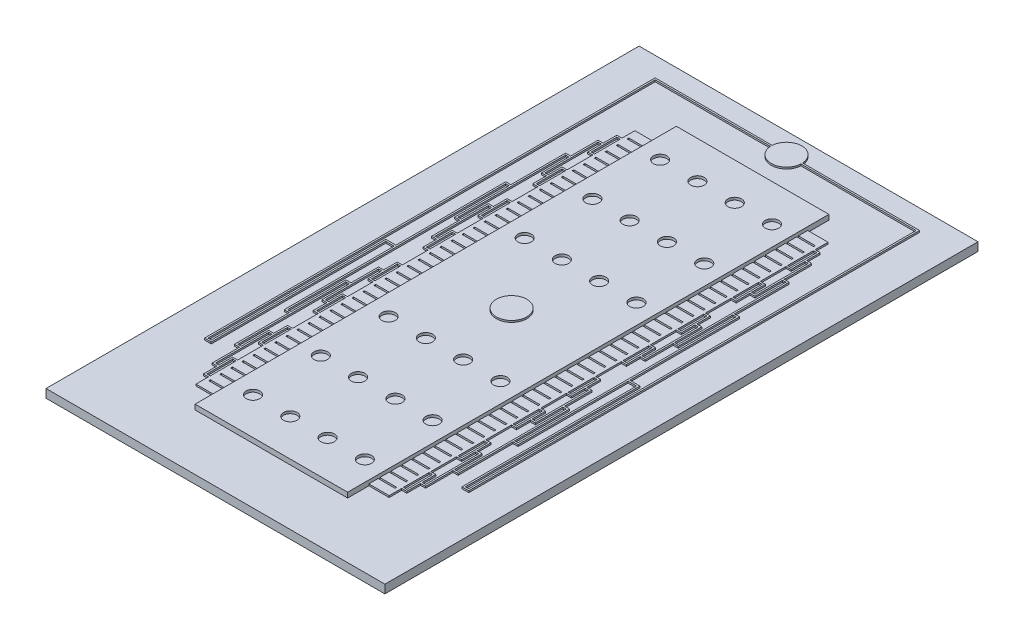
from build123d import *

# Parameters (mm, degrees)
SKETCH2_W           = 20
SKETCH2_H           = 35
BOSS_EXTRUDE1_DEPTH = 0.5
SKETCH3_W           = 9
SKETCH3_H           = 28.4
BOSS_EXTRUDE2_DEPTH = 0.3
SKETCH6_W           = 1.2
SKETCH6_H           = 25.9
BOSS_EXTRUDE3_DEPTH = 0.1
SKETCH8_W           = 1
SKETCH8_H           = 0.1
CUT_EXTRUDE1_DEPTH  = 0.1
BOSS_EXTRUDE4_DEPTH = 0.1
SKETCH10_R          = 0.9
BOSS_EXTRUDE5_DEPTH = 0.1
SKETCH11_R          = 0.4
CUT_EXTRUDE2_DEPTH  = 0.15


with BuildPart() as part:
    # Sketch2 → Boss-Extrude1 (new body)
    with BuildSketch(Plane(origin=(0, 0, 0), x_dir=(1, 0, 0), z_dir=(0, 1, 0))):
        Rectangle(SKETCH2_W, SKETCH2_H)
    extrude(amount=BOSS_EXTRUDE1_DEPTH)

    # Sketch3 → Boss-Extrude2 (add)
    with BuildSketch(Plane(origin=(0, 0.5, 0), x_dir=(1, 0, 0), z_dir=(0, 1, 0))):
        Rectangle(SKETCH3_W, SKETCH3_H)
    extrude(amount=BOSS_EXTRUDE2_DEPTH)

    # Sketch6 → Boss-Extrude3 (add)
    with BuildSketch(Plane(origin=(0, 0.5, 0), x_dir=(1, 0, 0), z_dir=(0, 1, 0))):
        with Locations((5.1, 0)):
            Rectangle(SKETCH6_W, SKETCH6_H)
        with Locations((-5.1, 0)):
            Rectangle(SKETCH6_W, SKETCH6_H)
    extrude(amount=BOSS_EXTRUDE3_DEPTH)

    # Sketch8 → Cut-Extrude1 (cut)
    with BuildSketch(Plane(origin=(0, 0.6, 0), x_dir=(1, 0, 0), z_dir=(0, 1, 0))):
        with Locations((5, 12.35)):
            Rectangle(SKETCH8_W, SKETCH8_H)
        with Locations((-5, 12.35)):
            Rectangle(SKETCH8_W, SKETCH8_H)
        with Locations((-5, 11.7)):
            Rectangle(SKETCH8_W, SKETCH8_H)
        with Locations((-5, 11.05)):
            Rectangle(SKETCH8_W, SKETCH8_H)
        with Locations((-5, 10.4)):
            Rectangle(SKETCH8_W, SKETCH8_H)
        with Locations((-5, 9.75)):
            Rectangle(SKETCH8_W, SKETCH8_H)
        with Locations((-5, 9.1)):
            Rectangle(SKETCH8_W, SKETCH8_H)
        with Locations((-5, 8.45)):
            Rectangle(SKETCH8_W, SKETCH8_H)
        with Locations((-5, 7.8)):
            Rectangle(SKETCH8_W, SKETCH8_H)
        with Locations((-5, 7.15)):
            Rectangle(SKETCH8_W, SKETCH8_H)
        with Locations((-5, 6.5)):
            Rectangle(SKETCH8_W, SKETCH8_H)
        with Locations((-5, 5.85)):
            Rectangle(SKETCH8_W, SKETCH8_H)
        with Locations((-5, 5.2)):
            Rectangle(SKETCH8_W, SKETCH8_H)
        with Locations((-5, 4.55)):
            Rectangle(SKETCH8_W, SKETCH8_H)
        with Locations((-5, 3.9)):
            Rectangle(SKETCH8_W, SKETCH8_H)
        with Locations((-5, 3.25)):
            Rectangle(SKETCH8_W, SKETCH8_H)
        with Locations((-5, 2.6)):
            Rectangle(SKETCH8_W, SKETCH8_H)
        with Locations((-5, 1.95)):
            Rectangle(SKETCH8_W, SKETCH8_H)
        with Locations((-5, 1.3)):
            Rectangle(SKETCH8_W, SKETCH8_H)
        with Locations((-5, 0.65)):
            Rectangle(SKETCH8_W, SKETCH8_H)
        with Locations((-5, 0)):
            Rectangle(SKETCH8_W, SKETCH8_H)
        with Locations((-5, -0.65)):
            Rectangle(SKETCH8_W, SKETCH8_H)
        with Locations((-5, -1.3)):
            Rectangle(SKETCH8_W, SKETCH8_H)
        with Locations((-5, -1.95)):
            Rectangle(SKETCH8_W, SKETCH8_H)
        with Locations((-5, -2.6)):
            Rectangle(SKETCH8_W, SKETCH8_H)
        with Locations((-5, -3.25)):
            Rectangle(SKETCH8_W, SKETCH8_H)
        with Locations((-5, -3.9)):
            Rectangle(SKETCH8_W, SKETCH8_H)
        with Locations((-5, -4.55)):
            Rectangle(SKETCH8_W, SKETCH8_H)
        with Locations((-5, -5.2)):
            Rectangle(SKETCH8_W, SKETCH8_H)
        with Locations((-5, -5.85)):
            Rectangle(SKETCH8_W, SKETCH8_H)
        with Locations((-5, -6.5)):
            Rectangle(SKETCH8_W, SKETCH8_H)
        with Locations((-5, -7.15)):
            Rectangle(SKETCH8_W, SKETCH8_H)
        with Locations((-5, -7.8)):
            Rectangle(SKETCH8_W, SKETCH8_H)
        with Locations((-5, -8.45)):
            Rectangle(SKETCH8_W, SKETCH8_H)
        with Locations((-5, -9.1)):
            Rectangle(SKETCH8_W, SKETCH8_H)
        with Locations((-5, -9.75)):
            Rectangle(SKETCH8_W, SKETCH8_H)
        with Locations((-5, -10.4)):
            Rectangle(SKETCH8_W, SKETCH8_H)
        with Locations((-5, -11.05)):
            Rectangle(SKETCH8_W, SKETCH8_H)
        with Locations((-5, -11.7)):
            Rectangle(SKETCH8_W, SKETCH8_H)
        with Locations((-5, -12.35)):
            Rectangle(SKETCH8_W, SKETCH8_H)
        with Locations((5, 11.7)):
            Rectangle(SKETCH8_W, SKETCH8_H)
        with Locations((5, 11.05)):
            Rectangle(SKETCH8_W, SKETCH8_H)
        with Locations((5, 10.4)):
            Rectangle(SKETCH8_W, SKETCH8_H)
        with Locations((5, 9.75)):
            Rectangle(SKETCH8_W, SKETCH8_H)
        with Locations((5, 9.1)):
            Rectangle(SKETCH8_W, SKETCH8_H)
        with Locations((5, 8.45)):
            Rectangle(SKETCH8_W, SKETCH8_H)
        with Locations((5, 7.8)):
            Rectangle(SKETCH8_W, SKETCH8_H)
        with Locations((5, 7.15)):
            Rectangle(SKETCH8_W, SKETCH8_H)
        with Locations((5, 6.5)):
            Rectangle(SKETCH8_W, SKETCH8_H)
        with Locations((5, 5.85)):
            Rectangle(SKETCH8_W, SKETCH8_H)
        with Locations((5, 5.2)):
            Rectangle(SKETCH8_W, SKETCH8_H)
        with Locations((5, 4.55)):
            Rectangle(SKETCH8_W, SKETCH8_H)
        with Locations((5, 3.9)):
            Rectangle(SKETCH8_W, SKETCH8_H)
        with Locations((5, 3.25)):
            Rectangle(SKETCH8_W, SKETCH8_H)
        with Locations((5, 2.6)):
            Rectangle(SKETCH8_W, SKETCH8_H)
        with Locations((5, 1.95)):
            Rectangle(SKETCH8_W, SKETCH8_H)
        with Locations((5, 1.3)):
            Rectangle(SKETCH8_W, SKETCH8_H)
        with Locations((5, 0.65)):
            Rectangle(SKETCH8_W, SKETCH8_H)
        with Locations((5, 0)):
            Rectangle(SKETCH8_W, SKETCH8_H)
        with Locations((5, -0.65)):
            Rectangle(SKETCH8_W, SKETCH8_H)
        with Locations((5, -1.3)):
            Rectangle(SKETCH8_W, SKETCH8_H)
        with Locations((5, -1.95)):
            Rectangle(SKETCH8_W, SKETCH8_H)
        with Locations((5, -2.6)):
            Rectangle(SKETCH8_W, SKETCH8_H)
        with Locations((5, -3.25)):
            Rectangle(SKETCH8_W, SKETCH8_H)
        with Locations((5, -3.9)):
            Rectangle(SKETCH8_W, SKETCH8_H)
        with Locations((5, -4.55)):
            Rectangle(SKETCH8_W, SKETCH8_H)
        with Locations((5, -5.2)):
            Rectangle(SKETCH8_W, SKETCH8_H)
        with Locations((5, -5.85)):
            Rectangle(SKETCH8_W, SKETCH8_H)
        with Locations((5, -6.5)):
            Rectangle(SKETCH8_W, SKETCH8_H)
        with Locations((5, -7.15)):
            Rectangle(SKETCH8_W, SKETCH8_H)
        with Locations((5, -7.8)):
            Rectangle(SKETCH8_W, SKETCH8_H)
        with Locations((5, -8.45)):
            Rectangle(SKETCH8_W, SKETCH8_H)
        with Locations((5, -9.1)):
            Rectangle(SKETCH8_W, SKETCH8_H)
        with Locations((5, -9.75)):
            Rectangle(SKETCH8_W, SKETCH8_H)
        with Locations((5, -10.4)):
            Rectangle(SKETCH8_W, SKETCH8_H)
        with Locations((5, -11.05)):
            Rectangle(SKETCH8_W, SKETCH8_H)
        with Locations((5, -11.7)):
            Rectangle(SKETCH8_W, SKETCH8_H)
        with Locations((5, -12.35)):
            Rectangle(SKETCH8_W, SKETCH8_H)
    extrude(amount=-CUT_EXTRUDE1_DEPTH, mode=Mode.SUBTRACT)

    # Sketch9 → Boss-Extrude4 (add)
    with BuildSketch(Plane(origin=(0, 0.5, 0), x_dir=(1, 0, 0), z_dir=(0, 1, 0))):
        with BuildLine():
            Line((-0.898610038, 16.25), (-7.8, 16.25))
            Line((-7.8, 16.25), (-7.8, -10.35))
            Line((-7.8, -10.35), (-7.4, -10.35))
            Line((-7.4, -10.35), (-7.4, -0.05))
            Line((-7.4, -0.05), (-6.9, -0.05))
            Line((-6.9, -0.05), (-6.9, -6.540001616))
            Line((-6.9, -6.540001616), (-6.6, -6.540001616))
            Line((-6.6, -6.540001616), (-6.6, -9.780003256))
            Line((-6.6, -9.780003256), (-6.300000001, -9.780003256))
            Line((-6.300000001, -9.780003256), (-6.3, -11.399999937))
            Line((-6.3, -11.399999937), (-6, -11.399999962))
            Line((-6, -11.399999962), (-6, -12.209999962))
            Line((-6, -12.209999962), (-5.7, -12.209999962))
            Line((-5.7, -12.209999962), (-5.7, -12.109999962))
            Line((-5.7, -12.109999962), (-5.9, -12.109999962))
            Line((-5.9, -12.109999962), (-5.9, -10.589999962))
            Line((-5.9, -10.589999962), (-5.7, -10.589999962))
            Line((-5.7, -10.589999962), (-5.7, -10.489999962))
            Line((-5.7, -10.489999962), (-6, -10.489999962))
            Line((-6, -10.489999962), (-6, -11.299999962))
            Line((-6, -11.299999962), (-6.2, -11.299999962))
            Line((-6.2, -11.299999962), (-6.2, -8.160006551))
            Line((-6.2, -8.160006551), (-6, -8.159999967))
            Line((-6, -8.159999967), (-6, -8.969999967))
            Line((-6, -8.969999967), (-5.7, -8.969999967))
            Line((-5.7, -8.969999967), (-5.7, -8.869999967))
            Line((-5.7, -8.869999967), (-5.9, -8.869999967))
            Line((-5.9, -8.869999967), (-5.9, -7.349999967))
            Line((-5.9, -7.349999967), (-5.7, -7.349999967))
            Line((-5.7, -7.349999967), (-5.7, -7.249999967))
            Line((-5.7, -7.249999967), (-6, -7.249999967))
            Line((-6, -7.249999967), (-6, -8.059999967))
            Line((-6, -8.059999967), (-6.3, -8.060013036))
            Line((-6.3, -8.060013036), (-6.3, -9.680003256))
            Line((-6.3, -9.680003256), (-6.5, -9.680003256))
            Line((-6.5, -9.680003256), (-6.5, -3.299999975))
            Line((-6.5, -3.299999975), (-6.3, -3.299999975))
            Line((-6.3, -3.299999975), (-6.3, -4.919999973))
            Line((-6.3, -4.919999973), (-6, -4.919999973))
            Line((-6, -4.919999973), (-6, -5.729999973))
            Line((-6, -5.729999973), (-5.7, -5.729999973))
            Line((-5.7, -5.729999973), (-5.7, -5.629999973))
            Line((-5.7, -5.629999973), (-5.9, -5.629999973))
            Line((-5.9, -5.629999973), (-5.9, -4.109999973))
            Line((-5.9, -4.109999973), (-5.7, -4.109999973))
            Line((-5.7, -4.109999973), (-5.7, -4.009999973))
            Line((-5.7, -4.009999973), (-6, -4.009999973))
            Line((-6, -4.009999973), (-6, -4.819999973))
            Line((-6, -4.819999973), (-6.2, -4.819999973))
            Line((-6.2, -4.819999973), (-6.2, -1.679999978))
            Line((-6.2, -1.679999978), (-6, -1.679999978))
            Line((-6, -1.679999978), (-6, -2.489999978))
            Line((-6, -2.489999978), (-5.7, -2.489999978))
            Line((-5.7, -2.489999978), (-5.7, -2.389999978))
            Line((-5.7, -2.389999978), (-5.9, -2.389999978))
            Line((-5.9, -2.389999978), (-5.9, -0.869999978))
            Line((-5.9, -0.869999978), (-5.7, -0.869999978))
            Line((-5.7, -0.869999978), (-5.7, -0.769999978))
            Line((-5.7, -0.769999978), (-6, -0.769999978))
            Line((-6, -0.769999978), (-6, -1.579999978))
            Line((-6, -1.579999978), (-6.3, -1.579999978))
            Line((-6.3, -1.579999978), (-6.3, -3.199999975))
            Line((-6.3, -3.199999975), (-6.6, -3.199999975))
            Line((-6.6, -3.199999975), (-6.6, -6.440001616))
            Line((-6.6, -6.440001616), (-6.8, -6.440001616))
            Line((-6.8, -6.440001616), (-6.8, 6.429035996))
            Line((-6.8, 6.429035996), (-6.6, 6.429035996))
            Line((-6.6, 6.429035996), (-6.6, 3.210434098))
            Line((-6.6, 3.210434098), (-6.3, 3.210434098))
            Line((-6.3, 3.210434098), (-6.3, 1.560000016))
            Line((-6.3, 1.560000016), (-6, 1.560000016))
            Line((-6, 1.560000016), (-6, 0.750000016))
            Line((-6, 0.750000016), (-5.7, 0.750000016))
            Line((-5.7, 0.750000016), (-5.7, 0.850000016))
            Line((-5.7, 0.850000016), (-5.9, 0.850000016))
            Line((-5.9, 0.850000016), (-5.9, 2.370000016))
            Line((-5.9, 2.370000016), (-5.7, 2.370000016))
            Line((-5.7, 2.370000016), (-5.7, 2.470000016))
            Line((-5.7, 2.470000016), (-6, 2.470000016))
            Line((-6, 2.470000016), (-6, 1.660000016))
            Line((-6, 1.660000016), (-6.199999999, 1.659982633))
            Line((-6.199999999, 1.659982633), (-6.199999999, 4.800000011))
            Line((-6.199999999, 4.800000011), (-6, 4.800000011))
            Line((-6, 4.800000011), (-6, 3.990000011))
            Line((-6, 3.990000011), (-5.7, 3.990000011))
            Line((-5.7, 3.990000011), (-5.7, 4.090000011))
            Line((-5.7, 4.090000011), (-5.9, 4.090000011))
            Line((-5.9, 4.090000011), (-5.9, 5.610000011))
            Line((-5.9, 5.610000011), (-5.7, 5.610000011))
            Line((-5.7, 5.610000011), (-5.7, 5.710000011))
            Line((-5.7, 5.710000011), (-6, 5.710000011))
            Line((-6, 5.710000011), (-6, 4.900000011))
            Line((-6, 4.900000011), (-6.3, 4.899986974))
            Line((-6.3, 4.899986974), (-6.3, 3.298076354))
            Line((-6.3, 3.298076354), (-6.5, 3.298076354))
            Line((-6.5, 3.298076354), (-6.5, 9.659995638))
            Line((-6.5, 9.659995638), (-6.3, 9.659995638))
            Line((-6.3, 9.659995638), (-6.3, 8.040000005))
            Line((-6.3, 8.040000005), (-6, 8.040000005))
            Line((-6, 8.040000005), (-6, 7.230000005))
            Line((-6, 7.230000005), (-5.7, 7.230000005))
            Line((-5.7, 7.230000005), (-5.7, 7.330000005))
            Line((-5.7, 7.330000005), (-5.9, 7.330000005))
            Line((-5.9, 7.330000005), (-5.9, 8.850000005))
            Line((-5.9, 8.850000005), (-5.7, 8.850000005))
            Line((-5.7, 8.850000005), (-5.7, 8.950000005))
            Line((-5.7, 8.950000005), (-6, 8.950000005))
            Line((-6, 8.950000005), (-6, 8.140000005))
            Line((-6, 8.140000005), (-6.2, 8.139982622))
            Line((-6.2, 8.139982622), (-6.2, 11.280008655))
            Line((-6.2, 11.280008655), (-6, 11.28))
            Line((-6, 11.28), (-6, 10.47))
            Line((-6, 10.47), (-5.7, 10.47))
            Line((-5.7, 10.47), (-5.7, 10.57))
            Line((-5.7, 10.57), (-5.9, 10.57))
            Line((-5.9, 10.57), (-5.9, 12.09))
            Line((-5.9, 12.09), (-5.7, 12.09))
            Line((-5.7, 12.09), (-5.7, 12.19))
            Line((-5.7, 12.19), (-6, 12.19))
            Line((-6, 12.19), (-6, 11.38))
            Line((-6, 11.38), (-6.3, 11.379986963))
            Line((-6.3, 11.379986963), (-6.3, 9.759995638))
            Line((-6.3, 9.759995638), (-6.6, 9.759995638))
            Line((-6.6, 9.759995638), (-6.6, 6.529035996))
            Line((-6.6, 6.529035996), (-6.9, 6.529035996))
            Line((-6.9, 6.529035996), (-6.9, 0.05))
            Line((-6.9, 0.05), (-7.5, 0.05))
            Line((-7.5, 0.05), (-7.5, -10.25))
            Line((-7.5, -10.25), (-7.7, -10.25))
            Line((-7.7, -10.25), (-7.7, 16.15))
            Line((-7.7, 16.15), (-0.898610038, 16.15))
            ThreePointArc((-0.898610038, 16.15), (0, 15.3), (0.898610038, 16.15))
            Line((0.898610038, 16.15), (7.7, 16.15))
            Line((7.7, 16.15), (7.7, -10.25))
            Line((7.7, -10.25), (7.5, -10.25))
            Line((7.5, -10.25), (7.5, 0.05))
            Line((7.5, 0.05), (6.9, 0.05))
            Line((6.9, 0.05), (6.9, 6.529035996))
            Line((6.9, 6.529035996), (6.6, 6.529035996))
            Line((6.6, 6.529035996), (6.6, 9.759995638))
            Line((6.6, 9.759995638), (6.3, 9.759995638))
            Line((6.3, 9.759995638), (6.3, 11.379986963))
            Line((6.3, 11.379986963), (6, 11.38))
            Line((6, 11.38), (6, 12.19))
            Line((6, 12.19), (5.7, 12.19))
            Line((5.7, 12.19), (5.7, 12.09))
            Line((5.7, 12.09), (5.9, 12.09))
            Line((5.9, 12.09), (5.9, 10.57))
            Line((5.9, 10.57), (5.7, 10.57))
            Line((5.7, 10.57), (5.7, 10.47))
            Line((5.7, 10.47), (6, 10.47))
            Line((6, 10.47), (6, 11.28))
            Line((6, 11.28), (6.2, 11.280008655))
            Line((6.2, 11.280008655), (6.2, 8.139982622))
            Line((6.2, 8.139982622), (6, 8.140000005))
            Line((6, 8.140000005), (6, 8.950000005))
            Line((6, 8.950000005), (5.7, 8.950000005))
            Line((5.7, 8.950000005), (5.7, 8.850000005))
            Line((5.7, 8.850000005), (5.9, 8.850000005))
            Line((5.9, 8.850000005), (5.9, 7.330000005))
            Line((5.9, 7.330000005), (5.7, 7.330000005))
            Line((5.7, 7.330000005), (5.7, 7.230000005))
            Line((5.7, 7.230000005), (6, 7.230000005))
            Line((6, 7.230000005), (6, 8.040000005))
            Line((6, 8.040000005), (6.3, 8.040000005))
            Line((6.3, 8.040000005), (6.3, 9.659995638))
            Line((6.3, 9.659995638), (6.5, 9.659995638))
            Line((6.5, 9.659995638), (6.5, 3.298076354))
            Line((6.5, 3.298076354), (6.3, 3.298076354))
            Line((6.3, 3.298076354), (6.3, 4.899986974))
            Line((6.3, 4.899986974), (6, 4.900000011))
            Line((6, 4.900000011), (6, 5.710000011))
            Line((6, 5.710000011), (5.7, 5.710000011))
            Line((5.7, 5.710000011), (5.7, 5.610000011))
            Line((5.7, 5.610000011), (5.9, 5.610000011))
            Line((5.9, 5.610000011), (5.9, 4.090000011))
            Line((5.9, 4.090000011), (5.7, 4.090000011))
            Line((5.7, 4.090000011), (5.7, 3.990000011))
            Line((5.7, 3.990000011), (6, 3.990000011))
            Line((6, 3.990000011), (6, 4.800000011))
            Line((6, 4.800000011), (6.199999999, 4.800000011))
            Line((6.199999999, 4.800000011), (6.199999999, 1.659982633))
            Line((6.199999999, 1.659982633), (6, 1.660000016))
            Line((6, 1.660000016), (6, 2.470000016))
            Line((6, 2.470000016), (5.7, 2.470000016))
            Line((5.7, 2.470000016), (5.7, 2.370000016))
            Line((5.7, 2.370000016), (5.9, 2.370000016))
            Line((5.9, 2.370000016), (5.9, 0.850000016))
            Line((5.9, 0.850000016), (5.7, 0.850000016))
            Line((5.7, 0.850000016), (5.7, 0.750000016))
            Line((5.7, 0.750000016), (6, 0.750000016))
            Line((6, 0.750000016), (6, 1.560000016))
            Line((6, 1.560000016), (6.3, 1.560000016))
            Line((6.3, 1.560000016), (6.3, 3.210434098))
            Line((6.3, 3.210434098), (6.6, 3.210434098))
            Line((6.6, 3.210434098), (6.6, 6.429035996))
            Line((6.6, 6.429035996), (6.8, 6.429035996))
            Line((6.8, 6.429035996), (6.8, -6.440001616))
            Line((6.8, -6.440001616), (6.6, -6.440001616))
            Line((6.6, -6.440001616), (6.6, -3.199999975))
            Line((6.6, -3.199999975), (6.3, -3.199999975))
            Line((6.3, -3.199999975), (6.3, -1.579999978))
            Line((6.3, -1.579999978), (6, -1.579999978))
            Line((6, -1.579999978), (6, -0.769999978))
            Line((6, -0.769999978), (5.7, -0.769999978))
            Line((5.7, -0.769999978), (5.7, -0.869999978))
            Line((5.7, -0.869999978), (5.9, -0.869999978))
            Line((5.9, -0.869999978), (5.9, -2.389999978))
            Line((5.9, -2.389999978), (5.7, -2.389999978))
            Line((5.7, -2.389999978), (5.7, -2.489999978))
            Line((5.7, -2.489999978), (6, -2.489999978))
            Line((6, -2.489999978), (6, -1.679999978))
            Line((6, -1.679999978), (6.2, -1.679999978))
            Line((6.2, -1.679999978), (6.2, -4.819999973))
            Line((6.2, -4.819999973), (6, -4.819999973))
            Line((6, -4.819999973), (6, -4.009999973))
            Line((6, -4.009999973), (5.7, -4.009999973))
            Line((5.7, -4.009999973), (5.7, -4.109999973))
            Line((5.7, -4.109999973), (5.9, -4.109999973))
            Line((5.9, -4.109999973), (5.9, -5.629999973))
            Line((5.9, -5.629999973), (5.7, -5.629999973))
            Line((5.7, -5.629999973), (5.7, -5.729999973))
            Line((5.7, -5.729999973), (6, -5.729999973))
            Line((6, -5.729999973), (6, -4.919999973))
            Line((6, -4.919999973), (6.3, -4.919999973))
            Line((6.3, -4.919999973), (6.3, -3.299999975))
            Line((6.3, -3.299999975), (6.5, -3.299999975))
            Line((6.5, -3.299999975), (6.5, -9.680003256))
            Line((6.5, -9.680003256), (6.3, -9.680003256))
            Line((6.3, -9.680003256), (6.3, -8.060013036))
            Line((6.3, -8.060013036), (6, -8.059999967))
            Line((6, -8.059999967), (6, -7.249999967))
            Line((6, -7.249999967), (5.7, -7.249999967))
            Line((5.7, -7.249999967), (5.7, -7.349999967))
            Line((5.7, -7.349999967), (5.9, -7.349999967))
            Line((5.9, -7.349999967), (5.9, -8.869999967))
            Line((5.9, -8.869999967), (5.7, -8.869999967))
            Line((5.7, -8.869999967), (5.7, -8.969999967))
            Line((5.7, -8.969999967), (6, -8.969999967))
            Line((6, -8.969999967), (6, -8.159999967))
            Line((6, -8.159999967), (6.2, -8.160006551))
            Line((6.2, -8.160006551), (6.2, -11.299999962))
            Line((6.2, -11.299999962), (6, -11.299999962))
            Line((6, -11.299999962), (6, -10.489999962))
            Line((6, -10.489999962), (5.7, -10.489999962))
            Line((5.7, -10.489999962), (5.7, -10.589999962))
            Line((5.7, -10.589999962), (5.9, -10.589999962))
            Line((5.9, -10.589999962), (5.9, -12.109999962))
            Line((5.9, -12.109999962), (5.7, -12.109999962))
            Line((5.7, -12.109999962), (5.7, -12.209999962))
            Line((5.7, -12.209999962), (6, -12.209999962))
            Line((6, -12.209999962), (6, -11.399999962))
            Line((6, -11.399999962), (6.3, -11.399999937))
            Line((6.3, -11.399999937), (6.300000001, -9.780003256))
            Line((6.300000001, -9.780003256), (6.6, -9.780003256))
            Line((6.6, -9.780003256), (6.6, -6.540001616))
            Line((6.6, -6.540001616), (6.9, -6.540001616))
            Line((6.9, -6.540001616), (6.9, -0.05))
            Line((6.9, -0.05), (7.4, -0.05))
            Line((7.4, -0.05), (7.4, -10.35))
            Line((7.4, -10.35), (7.8, -10.35))
            Line((7.8, -10.35), (7.8, 16.25))
            Line((7.8, 16.25), (0.898610038, 16.25))
            ThreePointArc((0.898610038, 16.25), (0, 17.1), (-0.898610038, 16.25))
        make_face()
    extrude(amount=BOSS_EXTRUDE4_DEPTH)

    # Sketch10 → Boss-Extrude5 (add)
    with BuildSketch(Plane(origin=(0, 0.8, 0), x_dir=(1, 0, 0), z_dir=(0, 1, 0))):
        with Locations((0.024961507, -0.049245916)):
            Circle(SKETCH10_R)
    extrude(amount=BOSS_EXTRUDE5_DEPTH)

    # Sketch11 → Cut-Extrude2 (cut)
    with BuildSketch(Plane(origin=(0, 0.8, 0), x_dir=(1, 0, 0), z_dir=(0, 1, 0))):
        with Locations((-3.269553867, 12.01316572)):
            Circle(SKETCH11_R)
        with Locations((-1.069553867, 12.01316572)):
            Circle(SKETCH11_R)
        with Locations((1.130446133, 12.01316572)):
            Circle(SKETCH11_R)
        with Locations((3.330446133, 12.01316572)):
            Circle(SKETCH11_R)
        with Locations((-1.069553867, 8.01316572)):
            Circle(SKETCH11_R)
        with Locations((1.130446133, 8.01316572)):
            Circle(SKETCH11_R)
        with Locations((3.330446133, 8.01316572)):
            Circle(SKETCH11_R)
        with Locations((-1.069553867, 4.01316572)):
            Circle(SKETCH11_R)
        with Locations((1.130446133, 4.01316572)):
            Circle(SKETCH11_R)
        with Locations((3.330446133, 4.01316572)):
            Circle(SKETCH11_R)
        with Locations((-3.269553867, 8.01316572)):
            Circle(SKETCH11_R)
        with Locations((-3.269553867, 4.01316572)):
            Circle(SKETCH11_R)
        with Locations((3.330446133, -4.01316572)):
            Circle(SKETCH11_R)
        with Locations((1.130446133, -4.01316572)):
            Circle(SKETCH11_R)
        with Locations((-1.069553867, -4.01316572)):
            Circle(SKETCH11_R)
        with Locations((-3.269553867, -4.01316572)):
            Circle(SKETCH11_R)
        with Locations((3.330446133, -8.01316572)):
            Circle(SKETCH11_R)
        with Locations((1.130446133, -8.01316572)):
            Circle(SKETCH11_R)
        with Locations((-1.069553867, -8.01316572)):
            Circle(SKETCH11_R)
        with Locations((-3.269553867, -8.01316572)):
            Circle(SKETCH11_R)
        with Locations((3.330446133, -12.01316572)):
            Circle(SKETCH11_R)
        with Locations((1.130446133, -12.01316572)):
            Circle(SKETCH11_R)
        with Locations((-1.069553867, -12.01316572)):
            Circle(SKETCH11_R)
        with Locations((-3.269553867, -12.01316572)):
            Circle(SKETCH11_R)
    extrude(amount=-CUT_EXTRUDE2_DEPTH, mode=Mode.SUBTRACT)


solid = part.part
